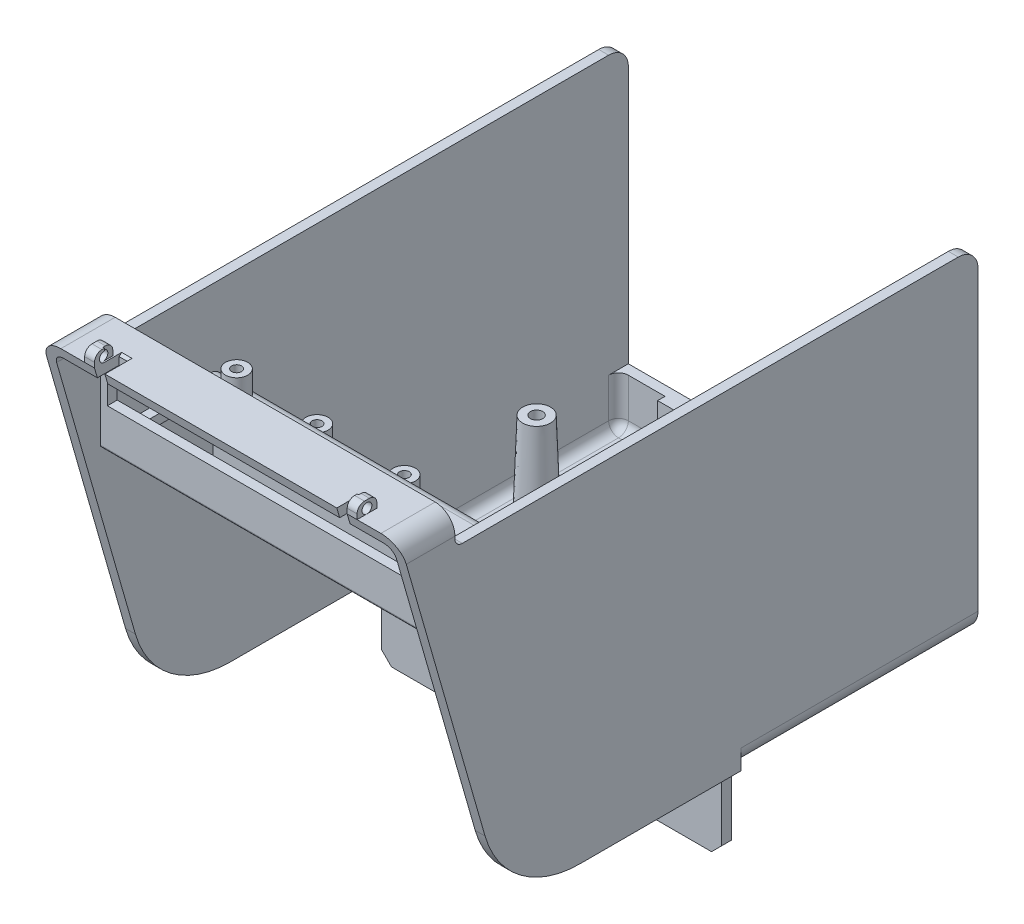
from build123d import *

# Parameters (mm, degrees)
BOSS_EXTRUDE1_DEPTH             = 66.66
BOSS_EXTRUDE1_DEPTH_BACK        = 7.5
SKETCH1_W                       = 72.85
SKETCH1_H                       = 108.98
CUT_EXTRUDE1_DEPTH              = 113.78226013
CUT_EXTRUDE1_DEPTH_BACK         = 113.78226013
FILLET1_R                       = 0.5
SHELL1_T                        = -2
CUT_EXTRUDE2_REACH              = 84.888
SKETCH3_W                       = 65
SKETCH3_H                       = 10
CUT_EXTRUDE3_REACH              = 79.417
SKETCH4_W                       = 65
SKETCH4_H                       = 10
CUT_EXTRUDE4_REACH              = 90.174
SKETCH5_W                       = 65
SKETCH5_H                       = 10
SKETCH7_R                       = 2.25
BOSS_EXTRUDE2_DEPTH             = 4.5
BOSS_EXTRUDE2_DIRECTION_2_REACH = 86.128
BOSS_EXTRUDE3_DEPTH             = 4.5
BOSS_EXTRUDE3_DEPTH_BACK        = 2
SKETCH8_R                       = 2.25
SKETCH9_R                       = 2.25
BOSS_EXTRUDE4_DEPTH             = 4.5
BOSS_EXTRUDE4_DIRECTION_2_REACH = 88.848
CUT_EXTRUDE5_REACH              = 134.842
SKETCH10_W                      = 66
SKETCH10_H                      = 6.5
SKETCH11_R                      = 3.5
BOSS_EXTRUDE5_DEPTH             = 19.72
BOSS_EXTRUDE5_DRAFT             = 2
BOSS_EXTRUDE5_PROFILE_2_DEPTH   = 19.72
BOSS_EXTRUDE5_PROFILE_2_DRAFT   = 2
BOSS_EXTRUDE6_DEPTH             = 2
SKETCH20_W                      = 68.85
SKETCH20_H                      = 10
BOSS_EXTRUDE7_DEPTH             = 2
CUT_EXTRUDE12_DEPTH             = 118.939129215
CUT_EXTRUDE6_REACH              = 106.811
SKETCH13_W                      = 68.85
SKETCH13_H                      = 2.5
FILLET4_R                       = 3
SKETCH14_W                      = 70.85
SKETCH14_H                      = 118.430630558
CUT_EXTRUDE7_DEPTH              = 1.5
CUT_EXTRUDE8_REACH              = 106.811
SKETCH16_R                      = 1.25
SKETCH17_R                      = 1
CUT_EXTRUDE9_DEPTH              = 4
SKETCH18_R                      = 1
CUT_EXTRUDE10_DEPTH             = 4
SKETCH19_R                      = 1
CUT_EXTRUDE11_DEPTH             = 4
SKETCH22_W                      = 107.98
SKETCH22_H                      = 6
CUT_EXTRUDE13_DEPTH             = 118.939129215
SKETCH23_W                      = 68.85
SKETCH23_H                      = 1
BOSS_EXTRUDE8_DEPTH             = 4
FILLET6_R                       = 2
FILLET7_R                       = 2
FILLET8_R                       = 4
SKETCH28_W                      = 68.85
SKETCH28_H                      = 2
BOSS_EXTRUDE10_DEPTH            = 15.2
CHAMFER2_SIZE                   = 2
SKETCH29_R                      = 1.75
CUT_EXTRUDE16_DEPTH             = 102.288381491
FILLET10_R                      = 2
CUT_EXTRUDE17_DEPTH             = 49.98
SKETCH31_W                      = 2.5
SKETCH31_H                      = 68.16
CUT_EXTRUDE18_DEPTH             = 89.83
BOSS_EXTRUDE11_START            = 0.52
BOSS_EXTRUDE11_DEPTH            = 0.52
SKETCH33_W                      = 68.85
SKETCH33_H                      = 2
BOSS_EXTRUDE12_DEPTH            = 10
FILLET11_R                      = 2
FILLET12_R                      = 4
FILLET13_R                      = 1.5
BOSS_EXTRUDE13_REACH            = 105.406
SKETCH34_W                      = 6
SKETCH34_H                      = 1.5
SKETCH35_R                      = 1.1
CUT_EXTRUDE19_DEPTH             = 3.5
FILLET14_R                      = 2
SKETCH37_W                      = 9
SKETCH37_H                      = 2
CUT_EXTRUDE20_DEPTH             = 130.596821817
SKETCH41_W                      = 2
SKETCH41_H                      = 4
BOSS_EXTRUDE15_DEPTH            = 2.5
SKETCH43_R                      = 1
CUT_EXTRUDE22_DEPTH             = 2
FILLET16_R                      = 1.5
FILLET16_OF_MIRROR3_R           = 1.5
SKETCH44_W                      = 2.1
SKETCH44_H                      = 4
CUT_EXTRUDE23_DEPTH             = 2
SKETCH45_W                      = 65
SKETCH45_H                      = 2
CUT_EXTRUDE24_DEPTH             = 1.5
SKETCH46_W                      = 65
SKETCH46_H                      = 2
CUT_EXTRUDE25_DEPTH             = 0.1
SKETCH47_W                      = 65
SKETCH47_H                      = 2
CUT_EXTRUDE26_DEPTH             = 0.1
SKETCH48_W                      = 65
SKETCH48_H                      = 2
BOSS_EXTRUDE16_DEPTH            = 1
SKETCH50_W                      = 2
SKETCH50_H                      = 2.5
CUT_EXTRUDE27_DEPTH             = 0.3
SKETCH51_W                      = 2
SKETCH51_H                      = 2.5
CUT_EXTRUDE28_DEPTH             = 0.3
SKETCH52_W                      = 2.1
SKETCH52_H                      = 2
CUT_EXTRUDE29_DEPTH             = 1
CHAMFER3_SIZE                   = 0.5


with BuildPart() as part:
    # Sketch1 → Boss-Extrude1 (new, two sides: drawn at the far end of the back side and taken through both)
    with BuildSketch(Plane(origin=(0, 0, 0), x_dir=(1, 0, 0), z_dir=(0, 1, 0)).offset(-BOSS_EXTRUDE1_DEPTH_BACK)):
        Rectangle(SKETCH1_W, SKETCH1_H)
    extrude(amount=BOSS_EXTRUDE1_DEPTH + BOSS_EXTRUDE1_DEPTH_BACK)

    # Sketch2 → Cut-Extrude1 (cut, two sides: drawn at the far end of the back side and taken through both)
    with BuildSketch(Plane(origin=(36.425, 0, 0), x_dir=(0, 0, -1), z_dir=(1, 0, 0)).offset(-CUT_EXTRUDE1_DEPTH_BACK)):
        Polygon((-54.49, 340.29873767), (-54.49, 66.66), (-54.49, 43.24), (-31.71, 43.24), (-31.71, 25.46), (-14.01, 25.46), (-14.01, 7.68), (2.51, 7.68), (2.51, -7.5), (2.51, -281.13873767), (-542.479756722, -331.126737051), (-599.479756722, 290.310738288), align=None)
    extrude(amount=CUT_EXTRUDE1_DEPTH + CUT_EXTRUDE1_DEPTH_BACK, mode=Mode.SUBTRACT)

    # Fillet1
    fillet1_edges = [part.edges().sort_by_distance(p)[0] for p in [
        (0, 43.24, 54.49),
        (0, 43.24, 31.71),
        (0, 25.46, 31.71),
        (0, 25.46, 14.01),
        (0, 7.68, 14.01),
        (0, 7.68, -2.51),
    ]]
    fillet(fillet1_edges, radius=FILLET1_R)

    # Shell1
    shell1_openings = [part.faces().sort_by_distance(p)[0] for p in [
        (0, 66.66, 0),
        (0, 29.58, -54.49),
    ]]
    offset(amount=SHELL1_T, openings=shell1_openings, kind=Kind.INTERSECTION)

    # Sketch3 → Cut-Extrude2 (cut, up to next)
    with BuildSketch(Plane.XZ.offset(-43.24), mode=Mode.PRIVATE) as cut_extrude2_sk1:
        with Locations((0, 42.39)):
            Rectangle(SKETCH3_W, SKETCH3_H)
    cut_extrude2_tool1 = extrude(cut_extrude2_sk1.sketch, amount=-CUT_EXTRUDE2_REACH, mode=Mode.PRIVATE) & part.part
    add(cut_extrude2_tool1.solids().sort_by_distance((0, 43.24, 42.39))[0], mode=Mode.SUBTRACT)

    # Sketch4 → Cut-Extrude3 (cut, up to next)
    with BuildSketch(Plane.XZ.offset(-25.46), mode=Mode.PRIVATE) as cut_extrude3_sk1:
        with Locations((0, 24.61)):
            Rectangle(SKETCH4_W, SKETCH4_H)
    cut_extrude3_tool1 = extrude(cut_extrude3_sk1.sketch, amount=-CUT_EXTRUDE3_REACH, mode=Mode.PRIVATE) & part.part
    add(cut_extrude3_tool1.solids().sort_by_distance((0, 25.46, 24.61))[0], mode=Mode.SUBTRACT)

    # Sketch5 → Cut-Extrude4 (cut, up to next)
    with BuildSketch(Plane.XZ.offset(-7.68), mode=Mode.PRIVATE) as cut_extrude4_sk1:
        with Locations((0, 6.91)):
            Rectangle(SKETCH5_W, SKETCH5_H)
    cut_extrude4_tool1 = extrude(cut_extrude4_sk1.sketch, amount=-CUT_EXTRUDE4_REACH, mode=Mode.PRIVATE) & part.part
    add(cut_extrude4_tool1.solids().sort_by_distance((0, 7.68, 6.91))[0], mode=Mode.SUBTRACT)

    # Sketch7 → Boss-Extrude2 (add)
    with BuildSketch(Plane(origin=(0, 45.24, 0), x_dir=(1, 0, 0), z_dir=(0, 1, 0))):
        with Locations(Location((-28, -33.29, 0), (0, 0, 270))):
            Circle(SKETCH7_R)
        with Locations(Location((28, -33.29, 0), (0, 0, 270))):
            Circle(SKETCH7_R)
    extrude(amount=BOSS_EXTRUDE2_DEPTH)

    # Sketch7 → Boss-Extrude2 direction 2 (add, up to next)
    with BuildSketch(Plane(origin=(0, 45.24, 0), x_dir=(1, 0, 0), z_dir=(0, 1, 0)), mode=Mode.PRIVATE) as boss_extrude2_direction_2_sk1:
        with Locations(Location((-28, -33.29, 0), (0, 0, 270))):
            Circle(SKETCH7_R)
    boss_extrude2_direction_2_tool1 = extrude(boss_extrude2_direction_2_sk1.sketch, amount=-BOSS_EXTRUDE2_DIRECTION_2_REACH, mode=Mode.PRIVATE) - part.part
    # Sketch7 → Boss-Extrude2 direction 2 (add, up to next)
    with BuildSketch(Plane(origin=(0, 45.24, 0), x_dir=(1, 0, 0), z_dir=(0, 1, 0)), mode=Mode.PRIVATE) as boss_extrude2_direction_2_sk2:
        with Locations(Location((28, -33.29, 0), (0, 0, 270))):
            Circle(SKETCH7_R)
    boss_extrude2_direction_2_tool2 = extrude(boss_extrude2_direction_2_sk2.sketch, amount=-BOSS_EXTRUDE2_DIRECTION_2_REACH, mode=Mode.PRIVATE) - part.part
    add(boss_extrude2_direction_2_tool1.solids().sort_by_distance((-28, 45.24, 33.29))[0])
    add(boss_extrude2_direction_2_tool2.solids().sort_by_distance((28, 45.24, 33.29))[0])

    # Sketch8 → Boss-Extrude3 (add, two sides: drawn at the far end of the back side and taken through both)
    with BuildSketch(Plane(origin=(0, 27.46, 0), x_dir=(1, 0, 0), z_dir=(0, 1, 0)).offset(-BOSS_EXTRUDE3_DEPTH_BACK)):
        with Locations(Location((-28, -17.01, 0), (0, 0, 270))):
            Circle(SKETCH8_R)
        with Locations(Location((28, -17.01, 0), (0, 0, 270))):
            Circle(SKETCH8_R)
    extrude(amount=BOSS_EXTRUDE3_DEPTH + BOSS_EXTRUDE3_DEPTH_BACK)

    # Sketch9 → Boss-Extrude4 (add)
    with BuildSketch(Plane(origin=(0, 9.68, 0), x_dir=(1, 0, 0), z_dir=(0, 1, 0))):
        with Locations(Location((-28, 0.69, 0), (0, 0, 270))):
            Circle(SKETCH9_R)
        with Locations(Location((28, 0.69, 0), (0, 0, 270))):
            Circle(SKETCH9_R)
    extrude(amount=BOSS_EXTRUDE4_DEPTH)

    # Sketch9 → Boss-Extrude4 direction 2 (add, up to next)
    with BuildSketch(Plane(origin=(0, 9.68, 0), x_dir=(1, 0, 0), z_dir=(0, 1, 0)), mode=Mode.PRIVATE) as boss_extrude4_direction_2_sk1:
        with Locations(Location((-28, 0.69, 0), (0, 0, 270))):
            Circle(SKETCH9_R)
    boss_extrude4_direction_2_tool1 = extrude(boss_extrude4_direction_2_sk1.sketch, amount=-BOSS_EXTRUDE4_DIRECTION_2_REACH, mode=Mode.PRIVATE) - part.part
    # Sketch9 → Boss-Extrude4 direction 2 (add, up to next)
    with BuildSketch(Plane(origin=(0, 9.68, 0), x_dir=(1, 0, 0), z_dir=(0, 1, 0)), mode=Mode.PRIVATE) as boss_extrude4_direction_2_sk2:
        with Locations(Location((28, 0.69, 0), (0, 0, 270))):
            Circle(SKETCH9_R)
    boss_extrude4_direction_2_tool2 = extrude(boss_extrude4_direction_2_sk2.sketch, amount=-BOSS_EXTRUDE4_DIRECTION_2_REACH, mode=Mode.PRIVATE) - part.part
    add(boss_extrude4_direction_2_tool1.solids().sort_by_distance((-28, 9.68, -0.69))[0])
    add(boss_extrude4_direction_2_tool2.solids().sort_by_distance((28, 9.68, -0.69))[0])

    # Sketch10 → Cut-Extrude5 (cut, up to next)
    with BuildSketch(Plane.XY.offset(54.49), mode=Mode.PRIVATE) as cut_extrude5_sk1:
        with Locations((0, 54.59)):
            Rectangle(SKETCH10_W, SKETCH10_H)
    cut_extrude5_tool1 = extrude(cut_extrude5_sk1.sketch, amount=-CUT_EXTRUDE5_REACH, mode=Mode.PRIVATE) & part.part
    add(cut_extrude5_tool1.solids().sort_by_distance((0, 54.59, 54.49))[0], mode=Mode.SUBTRACT)


with BuildPart() as boss_extrude5_tool:
    # Sketch11 → Boss-Extrude5 (with draft: the straight prism first)
    with BuildSketch(Plane(origin=(0, -5.5, 0), x_dir=(1, 0, 0), z_dir=(0, 1, 0))):
        with Locations((-25, 24.49)):
            Circle(SKETCH11_R)
    extrude(amount=BOSS_EXTRUDE5_DEPTH)
    # Boss-Extrude5: the draft: its side faces are tilted about the plane it starts from
    boss_extrude5_sides = [boss_extrude5_tool.faces().sort_by_distance(p)[0] for p in [
        (-28.5, 4.36, -24.49),
    ]]
    draft(boss_extrude5_sides, Plane(origin=(0, -5.5, 0), x_dir=(1, 0, 0), z_dir=(0, 1, 0)), BOSS_EXTRUDE5_DRAFT)


with BuildPart() as part_1:
    add(part.part)

    # Boss-Extrude5: add boss_extrude5_tool
    add(boss_extrude5_tool.part)


with BuildPart() as boss_extrude5_profile_2_tool:
    # Sketch11 → Boss-Extrude5 profile 2 (with draft: the straight prism first)
    with BuildSketch(Plane(origin=(0, -5.5, 0), x_dir=(1, 0, 0), z_dir=(0, 1, 0))):
        with Locations((25, 24.49)):
            Circle(SKETCH11_R)
    extrude(amount=BOSS_EXTRUDE5_PROFILE_2_DEPTH)
    # Boss-Extrude5 profile 2: the draft: its side faces are tilted about the plane it starts from
    boss_extrude5_profile_2_sides = [boss_extrude5_profile_2_tool.faces().sort_by_distance(p)[0] for p in [
        (21.5, 4.36, -24.49),
    ]]
    draft(boss_extrude5_profile_2_sides, Plane(origin=(0, -5.5, 0), x_dir=(1, 0, 0), z_dir=(0, 1, 0)), BOSS_EXTRUDE5_PROFILE_2_DRAFT)


with BuildPart() as part_2:
    add(part_1.part)

    # Boss-Extrude5 profile 2: add boss_extrude5_profile_2_tool
    add(boss_extrude5_profile_2_tool.part)

    # Sketch12 → Boss-Extrude6 (add)
    with BuildSketch(Plane.ZY.offset(36.425)):
        with BuildLine():
            Line((54.49, 66.66), (64.49, 66.66))
            Line((64.49, 66.66), (47.379115109, 6.987252884))
            ThreePointArc((47.379115109, 6.987252884), (40.190181653, -3.472710201), (28.15388119, -7.5))
            Line((28.15388119, -7.5), (-54.49, -7.5))
            Line((-54.49, -7.5), (54.49, 66.66))
        make_face()
    boss_extrude6 = extrude(amount=-BOSS_EXTRUDE6_DEPTH)

    # Mirror1: Boss-Extrude6 across plane
    add(boss_extrude6.mirror(Plane(origin=(0, 0, 0), x_dir=(0, 0, 1), z_dir=(1, 0, 0))))

    # Sketch20 → Boss-Extrude7 (add)
    with BuildSketch(Plane(origin=(0, 66.66, 0), x_dir=(1, 0, 0), z_dir=(0, 1, 0))):
        with Locations((0, -59.49)):
            Rectangle(SKETCH20_W, SKETCH20_H)
    extrude(amount=-BOSS_EXTRUDE7_DEPTH)

    # Sketch21 → Cut-Extrude12 (cut, through all)
    with BuildSketch(Plane(origin=(36.425, 0, 0), x_dir=(0, 0, -1), z_dir=(1, 0, 0))):
        Polygon((-64.49, 66.66), (-63.712511028, 63.948573728), (-66.437180196, 63.948573728), align=None)
    extrude(amount=-CUT_EXTRUDE12_DEPTH, mode=Mode.SUBTRACT)

    # Sketch13 → Cut-Extrude6 (cut, up to next)
    with BuildSketch(Plane.XZ.offset(7.5), mode=Mode.PRIVATE) as cut_extrude6_sk1:
        with Locations((0, -53.24)):
            Rectangle(SKETCH13_W, SKETCH13_H)
    cut_extrude6_tool1 = extrude(cut_extrude6_sk1.sketch, amount=-CUT_EXTRUDE6_REACH, mode=Mode.PRIVATE) & part_2.part
    add(cut_extrude6_tool1.solids().sort_by_distance((0, -7.5, -53.24))[0], mode=Mode.SUBTRACT)

    # Fillet4
    fillet4_edges = [part_2.edges().sort_by_distance(p)[0] for p in [
        (35.425, 66.66, -54.49),
        (-35.425, 66.66, -54.49),
    ]]
    fillet(fillet4_edges, radius=FILLET4_R)

    # Sketch14 → Cut-Extrude7 (cut)
    with BuildSketch(Plane(origin=(0, 66.66, 0), x_dir=(1, 0, 0), z_dir=(0, 1, 0))):
        with Locations((0, 5.725315279)):
            Rectangle(SKETCH14_W, SKETCH14_H)
    extrude(amount=-CUT_EXTRUDE7_DEPTH, mode=Mode.SUBTRACT)

    # Sketch16 → Cut-Extrude8 (cut, up to next)
    with BuildSketch(Plane.XZ.offset(7.5), mode=Mode.PRIVATE) as cut_extrude8_sk1:
        with Locations(Location((-25, -24.49, 0), (0, 0, 270))):
            Circle(SKETCH16_R)
    cut_extrude8_tool1 = extrude(cut_extrude8_sk1.sketch, amount=-CUT_EXTRUDE8_REACH, mode=Mode.PRIVATE) & part_2.part
    # Sketch16 → Cut-Extrude8 (cut, up to next)
    with BuildSketch(Plane.XZ.offset(7.5), mode=Mode.PRIVATE) as cut_extrude8_sk2:
        with Locations(Location((25, -24.49, 0), (0, 0, 270))):
            Circle(SKETCH16_R)
    cut_extrude8_tool2 = extrude(cut_extrude8_sk2.sketch, amount=-CUT_EXTRUDE8_REACH, mode=Mode.PRIVATE) & part_2.part
    add(cut_extrude8_tool1.solids().sort_by_distance((-25, -7.5, -24.49))[0], mode=Mode.SUBTRACT)
    add(cut_extrude8_tool2.solids().sort_by_distance((25, -7.5, -24.49))[0], mode=Mode.SUBTRACT)

    # Sketch17 → Cut-Extrude9 (cut)
    with BuildSketch(Plane(origin=(0, 14.18, 0), x_dir=(1, 0, 0), z_dir=(0, 1, 0))):
        with Locations(Location((-28, 0.69, 0), (0, 0, 270))):
            Circle(SKETCH17_R)
        with Locations(Location((28, 0.69, 0), (0, 0, 270))):
            Circle(SKETCH17_R)
    extrude(amount=-CUT_EXTRUDE9_DEPTH, mode=Mode.SUBTRACT)

    # Sketch18 → Cut-Extrude10 (cut)
    with BuildSketch(Plane(origin=(0, 31.96, 0), x_dir=(1, 0, 0), z_dir=(0, 1, 0))):
        with Locations(Location((-28, -17.01, 0), (0, 0, 270))):
            Circle(SKETCH18_R)
        with Locations(Location((28, -17.01, 0), (0, 0, 270))):
            Circle(SKETCH18_R)
    extrude(amount=-CUT_EXTRUDE10_DEPTH, mode=Mode.SUBTRACT)

    # Sketch19 → Cut-Extrude11 (cut)
    with BuildSketch(Plane(origin=(0, 49.74, 0), x_dir=(1, 0, 0), z_dir=(0, 1, 0))):
        with Locations(Location((-28, -33.29, 0), (0, 0, 270))):
            Circle(SKETCH19_R)
        with Locations(Location((28, -33.29, 0), (0, 0, 270))):
            Circle(SKETCH19_R)
    extrude(amount=-CUT_EXTRUDE11_DEPTH, mode=Mode.SUBTRACT)

    # Sketch22 → Cut-Extrude13 (cut, through all)
    with BuildSketch(Plane(origin=(36.425, 0, 0), x_dir=(0, 0, -1), z_dir=(1, 0, 0))):
        with Locations((0.5, 63.66)):
            Rectangle(SKETCH22_W, SKETCH22_H)
    extrude(amount=-CUT_EXTRUDE13_DEPTH, mode=Mode.SUBTRACT)

    # Sketch23 → Boss-Extrude8 (add)
    with BuildSketch(Plane(origin=(0, 60.66, 0), x_dir=(1, 0, 0), z_dir=(0, 1, 0))):
        with Locations((0, -52.99)):
            Rectangle(SKETCH23_W, SKETCH23_H)
    extrude(amount=BOSS_EXTRUDE8_DEPTH)

    # Fillet6
    fillet6_edges = [part_2.edges().sort_by_distance(p)[0] for p in [
        (34.425, 64.66, 52.99),
        (-34.425, 64.66, 52.99),
    ]]
    fillet(fillet6_edges, radius=FILLET6_R)

    # Fillet7
    fillet7_edges = [part_2.edges().sort_by_distance(p)[0] for p in [
        (34.425, 64.66, 59.203254614),
        (-34.425, 64.66, 59.203254614),
    ]]
    fillet(fillet7_edges, radius=FILLET7_R)

    # Fillet8
    fillet8_edges = [part_2.edges().sort_by_distance(p)[0] for p in [
        (36.425, 66.66, 58.99),
        (-36.425, 66.66, 58.99),
    ]]
    fillet(fillet8_edges, radius=FILLET8_R)

    # Sketch28 → Boss-Extrude10 (add)
    with BuildSketch(Plane.XZ.offset(7.5)):
        with Locations((0, -3.51)):
            Rectangle(SKETCH28_W, SKETCH28_H)
    extrude(amount=BOSS_EXTRUDE10_DEPTH)

    # Chamfer2
    chamfer2_edges = [part_2.edges().sort_by_distance(p)[0] for p in [
        (-34.425, -22.7, -3.51),
        (34.425, -22.7, -3.51),
    ]]
    chamfer(chamfer2_edges, length=CHAMFER2_SIZE)

    # Sketch29 → Cut-Extrude16 (cut, through all)
    with BuildSketch(Plane.XY.offset(-2.51)):
        with Locations((-24.425, -14.7)):
            Circle(SKETCH29_R)
        with Locations((24.425, -14.7)):
            Circle(SKETCH29_R)
    extrude(amount=-CUT_EXTRUDE16_DEPTH, mode=Mode.SUBTRACT)

    # Fillet10
    fillet10_edges = [part_2.edges().sort_by_distance(p)[0] for p in [
        (-34.425, -5.5, -28.25),
        (34.425, -5.5, -28.25),
    ]]
    fillet(fillet10_edges, radius=FILLET10_R)

    # Sketch30 → Cut-Extrude17 (cut)
    with BuildSketch(Plane(origin=(0, 0, -54.49), x_dir=(-1, 0, 0), z_dir=(0, 0, -1))):
        with BuildLine():
            Line((-36.425, -3.5), (-36.425, -7.5))
            Line((-36.425, -7.5), (-32.425, -7.5))
            ThreePointArc((-32.425, -7.5), (-35.253427125, -6.328427125), (-36.425, -3.5))
        make_face()
        with BuildLine():
            Line((36.425, -7.5), (32.425, -7.5))
            ThreePointArc((32.425, -7.5), (35.253427125, -6.328427125), (36.425, -3.5))
            Line((36.425, -3.5), (36.425, -7.5))
        make_face()
    extrude(amount=-CUT_EXTRUDE17_DEPTH, mode=Mode.SUBTRACT)

    # Sketch31 → Cut-Extrude18 (cut, symmetric)
    with BuildSketch(Plane.ZY):
        with Locations((-53.24, 26.58)):
            Rectangle(SKETCH31_W, SKETCH31_H)
    extrude(amount=CUT_EXTRUDE18_DEPTH, both=True, mode=Mode.SUBTRACT)

    # Sketch32 → Boss-Extrude11 (add)
    with BuildSketch(Plane(origin=(0, 0, -51.99), x_dir=(-1, 0, 0), z_dir=(0, 0, -1)).offset(BOSS_EXTRUDE11_START)):
        with BuildLine():
            Line((-34.425, -3.5), (-34.425, 60.66))
            Line((-34.425, 60.66), (-36.425, 60.66))
            Line((-36.425, 60.66), (-36.425, -3.5))
            ThreePointArc((-36.425, -3.5), (-35.253427125, -6.328427125), (-32.425, -7.5))
            Line((-32.425, -7.5), (32.425, -7.5))
            ThreePointArc((32.425, -7.5), (35.253427125, -6.328427125), (36.425, -3.5))
            Line((36.425, -3.5), (36.425, 60.66))
            Line((36.425, 60.66), (34.425, 60.66))
            Line((34.425, 60.66), (34.425, -3.5))
            ThreePointArc((34.425, -3.5), (33.839213562, -4.914213562), (32.425, -5.5))
            Line((32.425, -5.5), (-32.425, -5.5))
            ThreePointArc((-32.425, -5.5), (-33.839213562, -4.914213562), (-34.425, -3.5))
        make_face()
    extrude(amount=-BOSS_EXTRUDE11_DEPTH)

    # Sketch33 → Boss-Extrude12 (add)
    with BuildSketch(Plane(origin=(0, -5.5, 0), x_dir=(1, 0, 0), z_dir=(0, 1, 0))):
        with Locations((0, 51.51)):
            Rectangle(SKETCH33_W, SKETCH33_H)
    extrude(amount=BOSS_EXTRUDE12_DEPTH)

    # Fillet11
    fillet11_edges = [part_2.edges().sort_by_distance(p)[0] for p in [
        (33.839213562, -4.914213562, -50.51),
        (-34.425, 0.5, -50.51),
        (-33.839213562, -4.914213562, -50.51),
        (0, -5.5, -50.51),
        (34.425, 0.5, -50.51),
    ]]
    fillet(fillet11_edges, radius=FILLET11_R)

    # Fillet12
    fillet12_edges = [part_2.edges().sort_by_distance(p)[0] for p in [
        (35.425, 60.66, -52.51),
        (-35.425, 60.66, -52.51),
    ]]
    fillet(fillet12_edges, radius=FILLET12_R)

    # Fillet13
    # the kernel refuses this fillet: 1.5 mm, written as the material it adds along each edge
    with BuildSketch(Plane(origin=(-34.425, 60.66, 53.49), x_dir=(0, 0, -1), z_dir=(-1, 0, 0))) as fillet13_piece_1:
        with BuildLine():
            CenterArc((FILLET13_R, -FILLET13_R), FILLET13_R, 90, 90)
            Line((0, -FILLET13_R), (0, 0))
            Line((0, 0), (FILLET13_R, 0))
        make_face()
    extrude(amount=2)
    with BuildSketch(Plane(origin=(36.425, 60.66, 53.49), x_dir=(0, 1, 0), z_dir=(-1, 0, 0))) as fillet13_piece_2:
        with BuildLine():
            CenterArc((FILLET13_R, FILLET13_R), FILLET13_R, 180, 90)
            Line((0, FILLET13_R), (0, 0))
            Line((0, 0), (FILLET13_R, 0))
        make_face()
    extrude(amount=2)

    # Boss-Extrude13: up to this face of the body (flat: up to its plane)
    boss_extrude13_end = Plane(part_2.part.faces().sort_by_distance((0, 4.5, -51.49218452))[0])
    # Sketch34 → Boss-Extrude13 (add, up to the picked face)
    with BuildSketch(Plane(origin=(0, -5.5, 0), x_dir=(1, 0, 0), z_dir=(0, 1, 0)), mode=Mode.PRIVATE) as boss_extrude13_sk1:
        with Locations((-22, 49.76)):
            Rectangle(SKETCH34_W, SKETCH34_H)
    boss_extrude13_tool1 = split(extrude(boss_extrude13_sk1.sketch, amount=BOSS_EXTRUDE13_REACH, mode=Mode.PRIVATE), bisect_by=boss_extrude13_end, keep=Keep.BOTH, mode=Mode.PRIVATE)
    boss_extrude13 = boss_extrude13_tool1.solids().sort_by(Axis((-22, -5.5, -49.76), (0, 1, 0)))[0]
    add(boss_extrude13)

    # Sketch35 → Cut-Extrude19 (cut)
    with BuildSketch(Plane(origin=(0, 0, -52.51), x_dir=(-1, 0, 0), z_dir=(0, 0, -1))):
        with Locations((22, 0.5)):
            Circle(SKETCH35_R)
    cut_extrude19 = extrude(amount=-CUT_EXTRUDE19_DEPTH, mode=Mode.SUBTRACT)

    # Mirror2: Boss-Extrude13, Cut-Extrude19 across plane
    add(boss_extrude13.mirror(Plane(origin=(0, 0, 0), x_dir=(0, 0, 1), z_dir=(1, 0, 0))))
    add(cut_extrude19.mirror(Plane(origin=(0, 0, 0), x_dir=(0, 0, 1), z_dir=(1, 0, 0))), mode=Mode.SUBTRACT)

    # Fillet14
    # the kernel refuses this fillet: 2 mm, written as the material it adds along each edge
    with BuildSketch(Plane(origin=(37.425, 64.66, 54.49), x_dir=(0, 0, 1), z_dir=(-1, 0, 0))) as fillet14_piece_1_section:
        with BuildLine():
            CenterArc((FILLET14_R, -FILLET14_R), FILLET14_R, 90, 90)
            Line((0, -FILLET14_R), (0, 0))
            Line((0, 0), (FILLET14_R, 0))
        make_face()
    fillet14_piece_1 = extrude(amount=74.85, mode=Mode.PRIVATE)
    fillet14_piece_1 = split(fillet14_piece_1, bisect_by=Plane(origin=(34.425, 64.063727496, 54.836272503), z_dir=(-1, 0, 0)), keep=Keep.TOP, mode=Mode.PRIVATE)
    fillet14_piece_1 = split(fillet14_piece_1, bisect_by=Plane(origin=(-34.425, 64.063727496, 54.836272503), z_dir=(1, 0, 0)), keep=Keep.TOP, mode=Mode.PRIVATE)
    add(fillet14_piece_1)

    # Sketch37 → Cut-Extrude20 (cut, through all)
    with BuildSketch(Plane.XY.offset(52.49)):
        with Locations((-19, 63.66)):
            Rectangle(SKETCH37_W, SKETCH37_H)
        with Locations((19, 63.66)):
            Rectangle(SKETCH37_W, SKETCH37_H)
    extrude(amount=CUT_EXTRUDE20_DEPTH, mode=Mode.SUBTRACT)

    # Sketch41 → Boss-Extrude15 (add)
    with BuildSketch(Plane(origin=(0, 66.66, 0), x_dir=(1, 0, 0), z_dir=(0, 1, 0))):
        with Locations((-26.6, -62.49)):
            Rectangle(SKETCH41_W, SKETCH41_H)
    boss_extrude15 = extrude(amount=BOSS_EXTRUDE15_DEPTH)

    # Sketch43 → Cut-Extrude22 (cut)
    with BuildSketch(Plane(origin=(-25.6, 0, 0), x_dir=(0, 0, -1), z_dir=(1, 0, 0))):
        with Locations(Location((-62.49, 67.66, 0), (0, 0, 270))):
            Circle(SKETCH43_R)
    cut_extrude22 = extrude(amount=-CUT_EXTRUDE22_DEPTH, mode=Mode.SUBTRACT)

    # Fillet16
    fillet16_edges = [part_2.edges().sort_by_distance(p)[0] for p in [
        (-26.6, 69.16, 60.49),
        (-26.6, 69.16, 64.49),
    ]]
    fillet(fillet16_edges, radius=FILLET16_R)

    # Mirror3: Boss-Extrude15, Cut-Extrude22 across plane
    add(boss_extrude15.mirror(Plane(origin=(0, 0, 0), x_dir=(0, 0, 1), z_dir=(1, 0, 0))))
    add(cut_extrude22.mirror(Plane(origin=(0, 0, 0), x_dir=(0, 0, 1), z_dir=(1, 0, 0))), mode=Mode.SUBTRACT)

    # Fillet16 of Mirror3
    fillet16_of_mirror3_edges = [part_2.edges().sort_by_distance(p)[0] for p in [
        (26.6, 69.16, 60.49),
        (26.6, 69.16, 64.49),
    ]]
    fillet(fillet16_of_mirror3_edges, radius=FILLET16_OF_MIRROR3_R)

    # Sketch44 → Cut-Extrude23 (cut)
    with BuildSketch(Plane(origin=(0, 66.66, 0), x_dir=(1, 0, 0), z_dir=(0, 1, 0))):
        with Locations((-24.55, -62.49)):
            Rectangle(SKETCH44_W, SKETCH44_H)
        with Locations((24.55, -62.49)):
            Rectangle(SKETCH44_W, SKETCH44_H)
    extrude(amount=-CUT_EXTRUDE23_DEPTH, mode=Mode.SUBTRACT)

    # Sketch45 → Cut-Extrude24 (cut)
    with BuildSketch(Plane.XY.offset(37.39)):
        with Locations((0, 44.24)):
            Rectangle(SKETCH45_W, SKETCH45_H)
    extrude(amount=-CUT_EXTRUDE24_DEPTH, mode=Mode.SUBTRACT)

    # Sketch46 → Cut-Extrude25 (cut)
    with BuildSketch(Plane(origin=(0, 0, 29.61), x_dir=(-1, 0, 0), z_dir=(0, 0, -1))):
        with Locations((0, 26.46)):
            Rectangle(SKETCH46_W, SKETCH46_H)
    extrude(amount=-CUT_EXTRUDE25_DEPTH, mode=Mode.SUBTRACT)

    # Sketch47 → Cut-Extrude26 (cut)
    with BuildSketch(Plane(origin=(0, 0, 11.91), x_dir=(-1, 0, 0), z_dir=(0, 0, -1))):
        with Locations((0, 8.68)):
            Rectangle(SKETCH47_W, SKETCH47_H)
    extrude(amount=-CUT_EXTRUDE26_DEPTH, mode=Mode.SUBTRACT)

    # Sketch48 → Boss-Extrude16 (add)
    with BuildSketch(Plane(origin=(0, 0, 47.39), x_dir=(-1, 0, 0), z_dir=(0, 0, -1))):
        with Locations((0, 44.24)):
            Rectangle(SKETCH48_W, SKETCH48_H)
    extrude(amount=BOSS_EXTRUDE16_DEPTH)

    # Sketch50 → Cut-Extrude27 (cut)
    with BuildSketch(Plane(origin=(-25.6, 0, 0), x_dir=(0, 0, -1), z_dir=(1, 0, 0))):
        with Locations((-61.49, 67.91)):
            Rectangle(SKETCH50_W, SKETCH50_H)
    extrude(amount=-CUT_EXTRUDE27_DEPTH, mode=Mode.SUBTRACT)

    # Sketch51 → Cut-Extrude28 (cut)
    with BuildSketch(Plane.ZY.offset(-25.6)):
        with Locations((61.49, 67.91)):
            Rectangle(SKETCH51_W, SKETCH51_H)
    extrude(amount=-CUT_EXTRUDE28_DEPTH, mode=Mode.SUBTRACT)

    # Sketch52 → Cut-Extrude29 (cut)
    with BuildSketch(Plane.XY.offset(60.49)):
        with Locations((-24.55, 65.66)):
            Rectangle(SKETCH52_W, SKETCH52_H)
        with Locations((24.55, 65.66)):
            Rectangle(SKETCH52_W, SKETCH52_H)
    extrude(amount=-CUT_EXTRUDE29_DEPTH, mode=Mode.SUBTRACT)

    # Chamfer3
    chamfer3_edges = [part_2.edges().sort_by_distance(p)[0] for p in [
        (-24.55, 66.66, 59.49),
        (24.55, 66.66, 59.49),
    ]]
    chamfer(chamfer3_edges, length=CHAMFER3_SIZE)


solid = part_2.part
